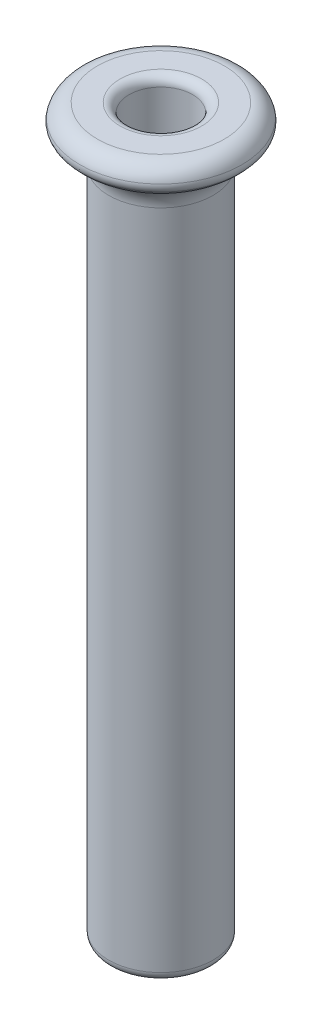
from build123d import *

# Parameters (mm, degrees)
FILLET1_R  = 3
FILLET3_R  = 2
FILLET4_R  = 1
FILLET7_R  = 0.5
FILLET9_R  = 1
FILLET10_R = 1
FILLET11_R = 3
FILLET12_R = 1
FILLET13_R = 1


with BuildPart() as part:
    # Sketch1 → Revolve1 (revolve)
    with BuildSketch(Plane.XY, mode=Mode.PRIVATE) as revolve1_sk:
        Polygon((9, 0), (3.5, 0), (3.5, -8), (2.6, -8), (2.6, -80), (5.75, -80), (5.75, -3), (9, -3), align=None)
    revolve(revolve1_sk.sketch.rotate(Axis((0, 0, 0), (0, -1, 0)), 180), axis=Axis((0, 0, 0), (0, -1, 0)))

    # Fillet1
    fillet1_edges = [part.edges().sort_by_distance(p)[0] for p in [
        (5.75, -3, 0),
    ]]
    fillet(fillet1_edges, radius=FILLET1_R)

    # Fillet3
    fillet3_edges = [part.edges().sort_by_distance(p)[0] for p in [
        (9, 0, 0),
    ]]
    fillet(fillet3_edges, radius=FILLET3_R)

    # Fillet4
    fillet4_edges = [part.edges().sort_by_distance(p)[0] for p in [
        (3.5, 0, 0),
    ]]
    fillet(fillet4_edges, radius=FILLET4_R)

    # Fillet7
    fillet7_edges = [part.edges().sort_by_distance(p)[0] for p in [
        (2.6, -8, 0),
    ]]
    fillet(fillet7_edges, radius=FILLET7_R)

    # Fillet9
    fillet9_edges = [part.edges().sort_by_distance(p)[0] for p in [
        (2.6, -80, 0),
    ]]
    fillet(fillet9_edges, radius=FILLET9_R)

    # Fillet10
    fillet10_edges = [part.edges().sort_by_distance(p)[0] for p in [
        (5.75, -80, 0),
    ]]
    fillet(fillet10_edges, radius=FILLET10_R)

    # Fillet11
    # the kernel refuses this fillet: 3 mm, written as the material it takes off along each edge
    with BuildSketch(Plane(origin=(0, -3, 0), x_dir=(-1, 0, 0), z_dir=(0, 0, 1))) as fillet11_piece_1:
        with BuildLine():
            CenterArc((6.418602734, -2.528524829), FILLET11_R, 30.631081829, 36.503603927)
            Line((9, -1), (9.258139727, -0.847147517))
            ThreePointArc((9.258139727, -0.847147517), (9.3, -0.5), (9.3, 0))
            Line((9.3, 0), (9, 0.3))
            ThreePointArc((9, 0.3), (8.75, 0.3), (7.70087123, 0.512163827))
            Line((7.70087123, 0.512163827), (7.584301367, 0.235737585))
        make_face()
    revolve(axis=Axis((0, -3, 0), (0, -1, 0)), mode=Mode.SUBTRACT)

    # Fillet12
    fillet12_edges = [part.edges().sort_by_distance(p)[0] for p in [
        (9, -2, 0),
    ]]
    fillet(fillet12_edges, radius=FILLET12_R)

    # Fillet13
    fillet13_edges = [part.edges().sort_by_distance(p)[0] for p in [
        (3.5, -8, 0),
    ]]
    fillet(fillet13_edges, radius=FILLET13_R)


solid = part.part
